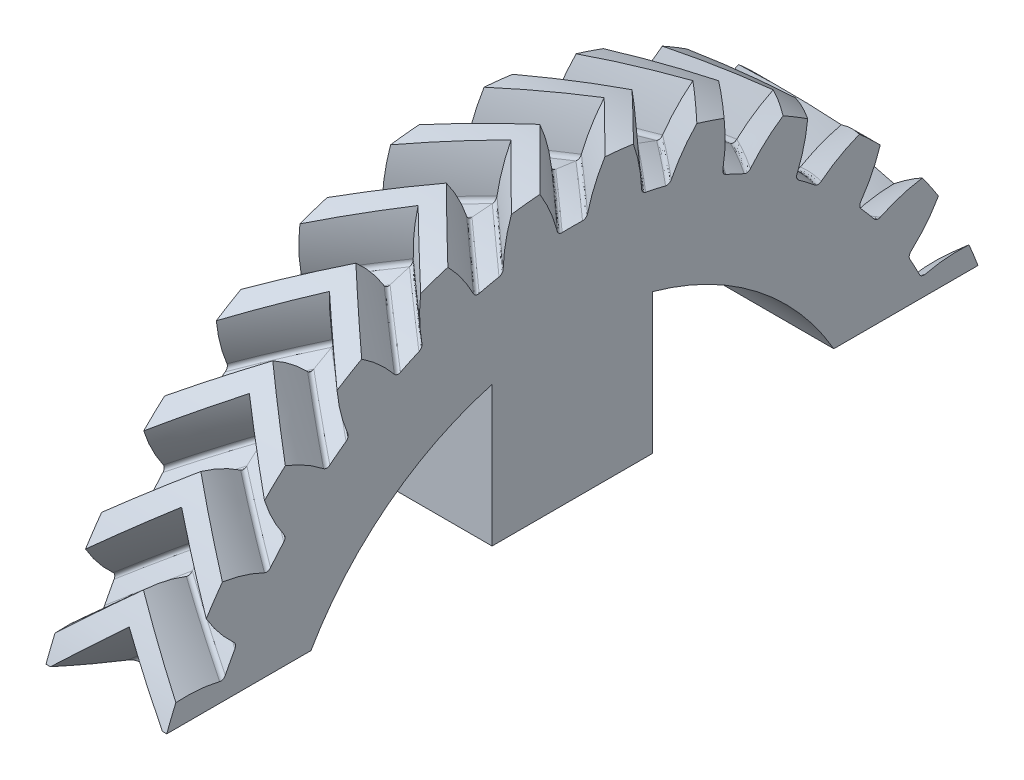
from build123d import *

# Parameters (mm, degrees)
BASPROSKE_W            = 3
BASPROSKE_H            = 21.506096654
TOOTHCUTLH_PITCH       = 135.126790514
TOOTHCUTLH_HEIGHT      = 3
TOOTHCUTLH_RADIUS      = 21.506096654
TOOTHCUTLH_START_ANGLE = -90
TEETHCUTSLH_COUNT      = 29
BORSKE_R               = 2
BORE_DEPTH             = 62.5000025
SKETCH_2_W             = 53.503814488
SKETCH_2_H             = 30
CUT_EXTRUDE_1_DEPTH    = 31.561812708
CUT_EXTRUDE_2_DEPTH    = 30.627260458


with BuildPart() as part:
    # BasProSke → Base-Revolve (revolve)
    with BuildSketch(Plane(origin=(0, 0, 0), x_dir=(1, 0, 0), z_dir=(0, 1, 0)), mode=Mode.PRIVATE) as base_revolve_sk:
        with Locations((1.5, 10.753048327)):
            Rectangle(BASPROSKE_W, BASPROSKE_H)
    revolve(base_revolve_sk.sketch.rotate(Axis((-10, 0, 0), (1, 0, 0)), 180), axis=Axis((-10, 0, 0), (1, 0, 0)))

    # ToothCutLH: sweep along a helix
    with BuildLine() as toothcutlh_path:
        add(Helix(TOOTHCUTLH_PITCH, TOOTHCUTLH_HEIGHT, TOOTHCUTLH_RADIUS, center=(0, 0, 0), direction=(1, 0, 0), lefthand=True, mode=Mode.PRIVATE).rotate(Axis((0, 0, 0), (1, 0, 0)), TOOTHCUTLH_START_ANGLE))
    # TooCutSkeRH<3> → ToothCutLH (sweep, cut)
    with BuildSketch(Plane(origin=(0, 0, 0), x_dir=(0, 0, -1), z_dir=(1, 0, 0))):
        with BuildLine():
            ThreePointArc((0.505297012, 19.249465792), (0, 19.256096654), (-0.505297012, 19.249465792))
            ThreePointArc((-0.505297012, 19.249465792), (-0.662900515, 19.299892818), (-0.754868381, 19.437456115))
            ThreePointArc((-0.754868381, 19.437456115), (-1.264180528, 20.812619399), (-2.03980054, 22.057162094))
            ThreePointArc((-2.03980054, 22.057162094), (0, 22.151279554), (2.03980054, 22.057162094))
            ThreePointArc((2.03980054, 22.057162094), (1.264180528, 20.812619399), (0.754868381, 19.437456115))
            ThreePointArc((0.754868381, 19.437456115), (0.662900515, 19.299892818), (0.505297012, 19.249465792))
        make_face()
    toothcutlh = sweep(path=toothcutlh_path.line, is_frenet=True, mode=Mode.SUBTRACT)

    # TeethCutsLH: ToothCutLH ×29 about axis
    teethcutslh_axis = Axis((-10, 0, 0), (1, 0, 0))
    for i in range(1, TEETHCUTSLH_COUNT):
        add(toothcutlh.rotate(teethcutslh_axis, i * 360 / TEETHCUTSLH_COUNT), mode=Mode.SUBTRACT)

    # BorSke → Bore (cut, symmetric)
    with BuildSketch(Plane(origin=(0, 0, 0), x_dir=(0, 0, -1), z_dir=(1, 0, 0))):
        with Locations(Location((0, 0, 0), (0, 0, 180))):
            Circle(BORSKE_R)
    extrude(amount=BORE_DEPTH, both=True, mode=Mode.SUBTRACT)

    # 草圖2 → 除料-伸長1 (cut, through all)
    with BuildSketch(Plane(origin=(0, 0, 0), x_dir=(0, 0, -1), z_dir=(1, 0, 0))):
        with Locations((0, -7.5)):
            Rectangle(SKETCH_2_W, SKETCH_2_H)
    extrude(amount=CUT_EXTRUDE_1_DEPTH, mode=Mode.SUBTRACT)

    # 草圖5 → 除料-伸長2 (cut, through all)
    with BuildSketch(Plane.ZY):
        with BuildLine():
            Line((-12.990381057, 7.5), (-3.990381057, 7.5))
            Line((-3.990381057, 7.5), (-3.990381057, 14.459490275))
            ThreePointArc((-3.990381057, 14.459490275), (-9.175794064, 11.866119976), (-12.990381057, 7.5))
        make_face()
        with BuildLine():
            Line((12.990381057, 7.5), (3.990381057, 7.5))
            Line((3.990381057, 7.5), (3.990381057, 14.459490275))
            ThreePointArc((3.990381057, 14.459490275), (9.175794064, 11.866119976), (12.990381057, 7.5))
        make_face()
    extrude(amount=-CUT_EXTRUDE_2_DEPTH, mode=Mode.SUBTRACT)

    # 鏡射1: part across plane


with BuildPart() as part_1:
    add(part.part)
    add(part.part.mirror(Plane.ZY.offset(-3)))


solid = part_1.part
